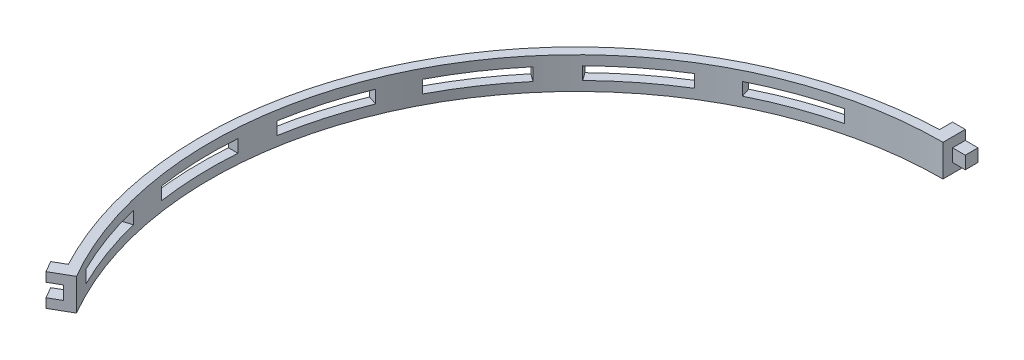
from build123d import *

# Parameters (mm, degrees)
BOSS_EXTRUDE1_DEPTH     = 10
SKETCH2_W               = 8
SKETCH2_H               = 4.2
CUT_EXTRUDE1_DEPTH      = 4
CIRPATTERN4_START       = 3
CIRPATTERN4_DEPTH       = 4
CIRPATTERN4_2_OUTLINE_W = 4
CIRPATTERN4_2_OUTLINE_H = 4
CIRPATTERN4_2_DEPTH     = 4


# Read off the part's stored shape, not the designer's step: CirPattern4
with BuildPart() as part:
    # Sketch1 → Boss-Extrude1 (new body)
    with BuildSketch(Plane(origin=(0, 0, 0), x_dir=(1, 0, 0), z_dir=(0, 1, 0))):
        with BuildLine():
            Line((-4, 122), (-4, 117.932183902))
            ThreePointArc((-4, 117.932183902), (-102.190997647, 59), (-104.132267183, -55.501990336))
            Line((-104.132267183, -55.501990336), (-107.655099262, -57.535898385))
            Line((-107.655099262, -57.535898385), (-105.655099262, -61))
            Line((-105.655099262, -61), (-99.592921435, -57.5))
            ThreePointArc((-99.592921435, -57.5), (-99.592921435, 57.5), (0, 115))
            Line((0, 115), (0, 122))
            Line((0, 122), (-4, 122))
        make_face()
    extrude(amount=BOSS_EXTRUDE1_DEPTH)

    # Sketch2 → Cut-Extrude1 (cut)
    with BuildSketch(Plane(origin=(-105.655099262, 0, 61), x_dir=(0.4999999999999976, 0, 0.86602540378444), z_dir=(-0.8660254037844402, 0, 0.4999999999999977))):
        with Locations((0, 5)):
            Rectangle(SKETCH2_W, SKETCH2_H)
    extrude(amount=-CUT_EXTRUDE1_DEPTH, mode=Mode.SUBTRACT)

    # CirPattern4 outline → CirPattern4 (cut)
    with BuildSketch(Plane(origin=(0, 0, 0), x_dir=(1, 0, 0), z_dir=(0, 1, 0)).offset(CIRPATTERN4_START)):
        with BuildLine():
            ThreePointArc((-51.017828253, 103.063966547), (-39.505073194, 108.001616617), (-27.523562684, 111.657751622))
            Line((-27.523562684, 111.657751622), (-28.45299166, 114.518239882))
            ThreePointArc((-28.45299166, 114.518239882), (-40.431539839, 110.857072784), (-51.954522475, 105.946814933))
            Line((-51.954522475, 105.946814933), (-51.017828253, 103.063966547))
        make_face()
        with BuildLine():
            ThreePointArc((-80.369355178, 82.254281033), (-70.945892242, 90.507902273), (-60.680606447, 97.68758366))
            Line((-60.680606447, 97.68758366), (-62.448485416, 100.12086031))
            ThreePointArc((-62.448485416, 100.12086031), (-72.709398865, 92.93730853), (-82.151053465, 84.706578343))
            Line((-82.151053465, 84.706578343), (-80.369355178, 82.254281033))
        make_face()
        with BuildLine():
            ThreePointArc((-101.853769652, 53.392973393), (-95.442033049, 64.154643849), (-87.897809664, 74.15507438))
            Line((-87.897809664, 74.15507438), (-90.331086315, 75.922953349))
            ThreePointArc((-90.331086315, 75.922953349), (-97.869955334, 65.920192984), (-104.306066962, 55.17467168))
            Line((-104.306066962, 55.17467168), (-101.853769652, 53.392973393))
        make_face()
        with BuildLine():
            ThreePointArc((-113.368027495, 19.305189506), (-110.595642677, 31.521481894), (-106.510962851, 43.363749751))
            Line((-106.510962851, 43.363749751), (-109.371451112, 44.293178727))
            ThreePointArc((-109.371451112, 44.293178727), (-113.450318674, 32.450349656), (-116.250875881, 20.241883728))
            Line((-116.250875881, 20.241883728), (-113.368027495, 19.305189506))
        make_face()
        with BuildLine():
            ThreePointArc((-113.785032926, -16.672320837), (-114.923380235, -4.197222333), (-114.698080889, 8.327679163))
            Line((-114.698080889, 8.327679163), (-117.705776238, 8.327679163))
            ThreePointArc((-117.705776238, 8.327679163), (-117.925374368, -4.195959991), (-116.816239102, -16.672320837))
            Line((-116.816239102, -16.672320837), (-113.785032926, -16.672320837))
        make_face()
        with BuildLine():
            ThreePointArc((-103.063966547, -51.017828253), (-108.001616617, -39.505073194), (-111.657751621, -27.523562684))
            Line((-111.657751621, -27.523562684), (-114.518239882, -28.45299166))
            ThreePointArc((-114.518239882, -28.45299166), (-110.857072784, -40.431539839), (-105.946814933, -51.954522475))
            Line((-105.946814933, -51.954522475), (-103.063966547, -51.017828253))
        make_face()
    extrude(amount=CIRPATTERN4_DEPTH, mode=Mode.SUBTRACT)

    # CirPattern4 2 outline → CirPattern4 2 (add)
    with BuildSketch(Plane(origin=(0, 0, 0), x_dir=(1, 0, 0), z_dir=(0, 1, 0)).offset(CIRPATTERN4_START)):
        with Locations((2, 120)):
            Rectangle(CIRPATTERN4_2_OUTLINE_W, CIRPATTERN4_2_OUTLINE_H)
    extrude(amount=CIRPATTERN4_2_DEPTH)


solid = part.part
